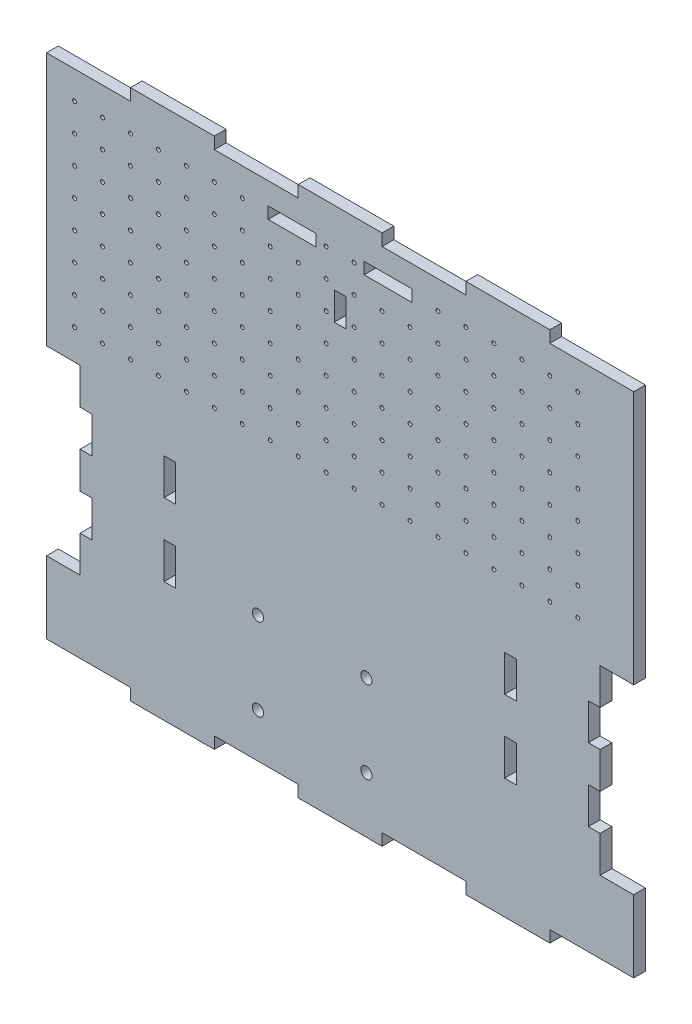
from build123d import *

# Parameters (mm, degrees)
SKETCH1_W           = 266.7
SKETCH1_H           = 241.3
BOSS_EXTRUDE1_DEPTH = 5.334
SKETCH2_W           = 15.24
SKETCH2_H           = 82.55
CUT_EXTRUDE1_DEPTH  = 180.908578328
SKETCH9_W           = 5.334
SKETCH9_H           = 16.51
CUT_EXTRUDE2_DEPTH  = 180.908578328
SKETCH10_R          = 2.54
CUT_EXTRUDE3_DEPTH  = 180.908578328
SKETCH23_W          = 5.334
SKETCH23_H          = 16.51
CUT_EXTRUDE8_DEPTH  = 180.908578328
SKETCH19_W          = 21.791696412
SKETCH19_H          = 5.334
CUT_EXTRUDE9_DEPTH  = 180.908578328
SKETCH19_5_W        = 21.791696412
SKETCH19_5_H        = 5.334
CUT_EXTRUDE11_DEPTH = 180.908578328
SKETCH27_W          = 5.334
SKETCH27_H          = 12.7
CUT_EXTRUDE12_DEPTH = 180.908578328
SKETCH28_W          = 38.1
SKETCH28_H          = 5.334
CUT_EXTRUDE13_DEPTH = 180.908578328
SKETCH29_W          = 38.1
SKETCH29_H          = 5.334
CUT_EXTRUDE14_DEPTH = 180.908578328
SKETCH30_R          = 0.889
CUT_EXTRUDE15_DEPTH = 180.908578328


with BuildPart() as part:
    # Sketch1 → Boss-Extrude1 (new body)
    with BuildSketch(Plane.XY):
        Rectangle(SKETCH1_W, SKETCH1_H)
    extrude(amount=BOSS_EXTRUDE1_DEPTH)

    # Sketch2 → Cut-Extrude1 (cut, through all)
    with BuildSketch(Plane(origin=(0, 0, 0), x_dir=(-1, 0, 0), z_dir=(0, 0, -1))):
        with Locations((125.73, -41.275)):
            Rectangle(SKETCH2_W, SKETCH2_H)
        with Locations((-125.73, -41.275)):
            Rectangle(SKETCH2_W, SKETCH2_H)
    extrude(amount=-CUT_EXTRUDE1_DEPTH, mode=Mode.SUBTRACT)

    # Sketch9 → Cut-Extrude2 (cut, through all)
    with BuildSketch(Plane.XY.offset(5.334)):
        with Locations((-115.443, -24.765)):
            Rectangle(SKETCH9_W, SKETCH9_H)
        with Locations((-115.443, -57.785)):
            Rectangle(SKETCH9_W, SKETCH9_H)
        with Locations((115.443, -57.785)):
            Rectangle(SKETCH9_W, SKETCH9_H)
        with Locations((115.443, -24.765)):
            Rectangle(SKETCH9_W, SKETCH9_H)
    extrude(amount=-CUT_EXTRUDE2_DEPTH, mode=Mode.SUBTRACT)

    # Sketch10 → Cut-Extrude3 (cut, through all)
    with BuildSketch(Plane.XY.offset(5.334)):
        with Locations((-37.338, -95.25)):
            Circle(SKETCH10_R)
        with Locations((11.938, -95.25)):
            Circle(SKETCH10_R)
        with Locations((11.938, -57.912)):
            Circle(SKETCH10_R)
        with Locations((-37.338, -57.912)):
            Circle(SKETCH10_R)
    extrude(amount=-CUT_EXTRUDE3_DEPTH, mode=Mode.SUBTRACT)

    # Sketch23 → Cut-Extrude8 (cut, through all)
    with BuildSketch(Plane.XY.offset(5.334)):
        with Locations((-77.343, -57.785)):
            Rectangle(SKETCH23_W, SKETCH23_H)
        with Locations((77.343, -24.765)):
            Rectangle(SKETCH23_W, SKETCH23_H)
        with Locations((77.343, -57.785)):
            Rectangle(SKETCH23_W, SKETCH23_H)
        with Locations((-77.343, -24.765)):
            Rectangle(SKETCH23_W, SKETCH23_H)
    extrude(amount=-CUT_EXTRUDE8_DEPTH, mode=Mode.SUBTRACT)

    # Sketch19 → Cut-Extrude9 (cut, through all)
    with BuildSketch(Plane.XY.offset(5.334)):
        with Locations((-21.791696412, 102.743)):
            Rectangle(SKETCH19_W, SKETCH19_H)
    extrude(amount=-CUT_EXTRUDE9_DEPTH, mode=Mode.SUBTRACT)

    # Sketch19<5> → Cut-Extrude11 (cut, through all)
    with BuildSketch(Plane.XY.offset(5.334)):
        with Locations((-21.791696412, 102.743)):
            Rectangle(SKETCH19_5_W, SKETCH19_5_H)
        with Locations((21.791696412, 102.743)):
            Rectangle(SKETCH19_5_W, SKETCH19_5_H)
    extrude(amount=-CUT_EXTRUDE11_DEPTH, mode=Mode.SUBTRACT)

    # Sketch27 → Cut-Extrude12 (cut, through all)
    with BuildSketch(Plane.XY.offset(5.334)):
        with Locations((0, 81.026)):
            Rectangle(SKETCH27_W, SKETCH27_H)
    extrude(amount=-CUT_EXTRUDE12_DEPTH, mode=Mode.SUBTRACT)

    # Sketch28 → Cut-Extrude13 (cut, through all)
    with BuildSketch(Plane(origin=(0, 0, 0), x_dir=(-1, 0, 0), z_dir=(0, 0, -1))):
        with Locations((-114.3, -117.983)):
            Rectangle(SKETCH28_W, SKETCH28_H)
        with Locations((-38.1, -117.983)):
            Rectangle(SKETCH28_W, SKETCH28_H)
        with Locations((38.1, -117.983)):
            Rectangle(SKETCH28_W, SKETCH28_H)
        with Locations((114.3, -117.983)):
            Rectangle(SKETCH28_W, SKETCH28_H)
    extrude(amount=-CUT_EXTRUDE13_DEPTH, mode=Mode.SUBTRACT)

    # Sketch29 → Cut-Extrude14 (cut, through all)
    with BuildSketch(Plane(origin=(0, 0, 0), x_dir=(-1, 0, 0), z_dir=(0, 0, -1))):
        with Locations((-114.3, 117.983)):
            Rectangle(SKETCH29_W, SKETCH29_H)
        with Locations((-38.1, 117.983)):
            Rectangle(SKETCH29_W, SKETCH29_H)
        with Locations((38.1, 117.983)):
            Rectangle(SKETCH29_W, SKETCH29_H)
        with Locations((114.3, 117.983)):
            Rectangle(SKETCH29_W, SKETCH29_H)
    extrude(amount=-CUT_EXTRUDE14_DEPTH, mode=Mode.SUBTRACT)

    # Sketch30 → Cut-Extrude15 (cut, through all)
    with BuildSketch(Plane.XY.offset(5.334)):
        with Locations((-120.65, 102.616)):
            Circle(SKETCH30_R)
        with Locations((-107.95, 102.616)):
            Circle(SKETCH30_R)
        with Locations((-95.25, 102.616)):
            Circle(SKETCH30_R)
        with Locations((-82.55, 102.616)):
            Circle(SKETCH30_R)
        with Locations((-69.85, 102.616)):
            Circle(SKETCH30_R)
        with Locations((-57.15, 102.616)):
            Circle(SKETCH30_R)
        with Locations((-44.45, 102.616)):
            Circle(SKETCH30_R)
        with Locations((-6.35, 102.616)):
            Circle(SKETCH30_R)
        with Locations((6.35, 102.616)):
            Circle(SKETCH30_R)
        with Locations((44.45, 102.616)):
            Circle(SKETCH30_R)
        with Locations((57.15, 102.616)):
            Circle(SKETCH30_R)
        with Locations((69.85, 102.616)):
            Circle(SKETCH30_R)
        with Locations((82.55, 102.616)):
            Circle(SKETCH30_R)
        with Locations((95.25, 102.616)):
            Circle(SKETCH30_R)
        with Locations((107.95, 102.616)):
            Circle(SKETCH30_R)
        with Locations((-107.95, 89.916)):
            Circle(SKETCH30_R)
        with Locations((-95.25, 89.916)):
            Circle(SKETCH30_R)
        with Locations((-82.55, 89.916)):
            Circle(SKETCH30_R)
        with Locations((-69.85, 89.916)):
            Circle(SKETCH30_R)
        with Locations((-57.15, 89.916)):
            Circle(SKETCH30_R)
        with Locations((-44.45, 89.916)):
            Circle(SKETCH30_R)
        with Locations((-31.75, 89.916)):
            Circle(SKETCH30_R)
        with Locations((-19.05, 89.916)):
            Circle(SKETCH30_R)
        with Locations((-6.35, 89.916)):
            Circle(SKETCH30_R)
        with Locations((6.35, 89.916)):
            Circle(SKETCH30_R)
        with Locations((19.05, 89.916)):
            Circle(SKETCH30_R)
        with Locations((31.75, 89.916)):
            Circle(SKETCH30_R)
        with Locations((44.45, 89.916)):
            Circle(SKETCH30_R)
        with Locations((57.15, 89.916)):
            Circle(SKETCH30_R)
        with Locations((69.85, 89.916)):
            Circle(SKETCH30_R)
        with Locations((82.55, 89.916)):
            Circle(SKETCH30_R)
        with Locations((95.25, 89.916)):
            Circle(SKETCH30_R)
        with Locations((107.95, 89.916)):
            Circle(SKETCH30_R)
        with Locations((-107.95, 77.216)):
            Circle(SKETCH30_R)
        with Locations((-95.25, 77.216)):
            Circle(SKETCH30_R)
        with Locations((-82.55, 77.216)):
            Circle(SKETCH30_R)
        with Locations((-69.85, 77.216)):
            Circle(SKETCH30_R)
        with Locations((-57.15, 77.216)):
            Circle(SKETCH30_R)
        with Locations((-44.45, 77.216)):
            Circle(SKETCH30_R)
        with Locations((-31.75, 77.216)):
            Circle(SKETCH30_R)
        with Locations((-19.05, 77.216)):
            Circle(SKETCH30_R)
        with Locations((-6.35, 77.216)):
            Circle(SKETCH30_R)
        with Locations((6.35, 77.216)):
            Circle(SKETCH30_R)
        with Locations((19.05, 77.216)):
            Circle(SKETCH30_R)
        with Locations((31.75, 77.216)):
            Circle(SKETCH30_R)
        with Locations((44.45, 77.216)):
            Circle(SKETCH30_R)
        with Locations((57.15, 77.216)):
            Circle(SKETCH30_R)
        with Locations((69.85, 77.216)):
            Circle(SKETCH30_R)
        with Locations((82.55, 77.216)):
            Circle(SKETCH30_R)
        with Locations((95.25, 77.216)):
            Circle(SKETCH30_R)
        with Locations((107.95, 77.216)):
            Circle(SKETCH30_R)
        with Locations((-107.95, 64.516)):
            Circle(SKETCH30_R)
        with Locations((-95.25, 64.516)):
            Circle(SKETCH30_R)
        with Locations((-82.55, 64.516)):
            Circle(SKETCH30_R)
        with Locations((-69.85, 64.516)):
            Circle(SKETCH30_R)
        with Locations((-57.15, 64.516)):
            Circle(SKETCH30_R)
        with Locations((-44.45, 64.516)):
            Circle(SKETCH30_R)
        with Locations((-31.75, 64.516)):
            Circle(SKETCH30_R)
        with Locations((-19.05, 64.516)):
            Circle(SKETCH30_R)
        with Locations((-6.35, 64.516)):
            Circle(SKETCH30_R)
        with Locations((6.35, 64.516)):
            Circle(SKETCH30_R)
        with Locations((19.05, 64.516)):
            Circle(SKETCH30_R)
        with Locations((31.75, 64.516)):
            Circle(SKETCH30_R)
        with Locations((44.45, 64.516)):
            Circle(SKETCH30_R)
        with Locations((57.15, 64.516)):
            Circle(SKETCH30_R)
        with Locations((69.85, 64.516)):
            Circle(SKETCH30_R)
        with Locations((82.55, 64.516)):
            Circle(SKETCH30_R)
        with Locations((95.25, 64.516)):
            Circle(SKETCH30_R)
        with Locations((107.95, 64.516)):
            Circle(SKETCH30_R)
        with Locations((-107.95, 51.816)):
            Circle(SKETCH30_R)
        with Locations((-95.25, 51.816)):
            Circle(SKETCH30_R)
        with Locations((-82.55, 51.816)):
            Circle(SKETCH30_R)
        with Locations((-69.85, 51.816)):
            Circle(SKETCH30_R)
        with Locations((-57.15, 51.816)):
            Circle(SKETCH30_R)
        with Locations((-44.45, 51.816)):
            Circle(SKETCH30_R)
        with Locations((-31.75, 51.816)):
            Circle(SKETCH30_R)
        with Locations((-19.05, 51.816)):
            Circle(SKETCH30_R)
        with Locations((-6.35, 51.816)):
            Circle(SKETCH30_R)
        with Locations((6.35, 51.816)):
            Circle(SKETCH30_R)
        with Locations((19.05, 51.816)):
            Circle(SKETCH30_R)
        with Locations((31.75, 51.816)):
            Circle(SKETCH30_R)
        with Locations((44.45, 51.816)):
            Circle(SKETCH30_R)
        with Locations((57.15, 51.816)):
            Circle(SKETCH30_R)
        with Locations((69.85, 51.816)):
            Circle(SKETCH30_R)
        with Locations((82.55, 51.816)):
            Circle(SKETCH30_R)
        with Locations((95.25, 51.816)):
            Circle(SKETCH30_R)
        with Locations((107.95, 51.816)):
            Circle(SKETCH30_R)
        with Locations((-107.95, 39.116)):
            Circle(SKETCH30_R)
        with Locations((-95.25, 39.116)):
            Circle(SKETCH30_R)
        with Locations((-82.55, 39.116)):
            Circle(SKETCH30_R)
        with Locations((-69.85, 39.116)):
            Circle(SKETCH30_R)
        with Locations((-57.15, 39.116)):
            Circle(SKETCH30_R)
        with Locations((-44.45, 39.116)):
            Circle(SKETCH30_R)
        with Locations((-31.75, 39.116)):
            Circle(SKETCH30_R)
        with Locations((-19.05, 39.116)):
            Circle(SKETCH30_R)
        with Locations((-6.35, 39.116)):
            Circle(SKETCH30_R)
        with Locations((6.35, 39.116)):
            Circle(SKETCH30_R)
        with Locations((19.05, 39.116)):
            Circle(SKETCH30_R)
        with Locations((31.75, 39.116)):
            Circle(SKETCH30_R)
        with Locations((44.45, 39.116)):
            Circle(SKETCH30_R)
        with Locations((57.15, 39.116)):
            Circle(SKETCH30_R)
        with Locations((69.85, 39.116)):
            Circle(SKETCH30_R)
        with Locations((82.55, 39.116)):
            Circle(SKETCH30_R)
        with Locations((95.25, 39.116)):
            Circle(SKETCH30_R)
        with Locations((107.95, 39.116)):
            Circle(SKETCH30_R)
        with Locations((-107.95, 26.416)):
            Circle(SKETCH30_R)
        with Locations((-95.25, 26.416)):
            Circle(SKETCH30_R)
        with Locations((-82.55, 26.416)):
            Circle(SKETCH30_R)
        with Locations((-69.85, 26.416)):
            Circle(SKETCH30_R)
        with Locations((-57.15, 26.416)):
            Circle(SKETCH30_R)
        with Locations((-44.45, 26.416)):
            Circle(SKETCH30_R)
        with Locations((-31.75, 26.416)):
            Circle(SKETCH30_R)
        with Locations((-19.05, 26.416)):
            Circle(SKETCH30_R)
        with Locations((-6.35, 26.416)):
            Circle(SKETCH30_R)
        with Locations((6.35, 26.416)):
            Circle(SKETCH30_R)
        with Locations((19.05, 26.416)):
            Circle(SKETCH30_R)
        with Locations((31.75, 26.416)):
            Circle(SKETCH30_R)
        with Locations((44.45, 26.416)):
            Circle(SKETCH30_R)
        with Locations((57.15, 26.416)):
            Circle(SKETCH30_R)
        with Locations((69.85, 26.416)):
            Circle(SKETCH30_R)
        with Locations((82.55, 26.416)):
            Circle(SKETCH30_R)
        with Locations((95.25, 26.416)):
            Circle(SKETCH30_R)
        with Locations((107.95, 26.416)):
            Circle(SKETCH30_R)
        with Locations((-107.95, 13.716)):
            Circle(SKETCH30_R)
        with Locations((-95.25, 13.716)):
            Circle(SKETCH30_R)
        with Locations((-82.55, 13.716)):
            Circle(SKETCH30_R)
        with Locations((-69.85, 13.716)):
            Circle(SKETCH30_R)
        with Locations((-57.15, 13.716)):
            Circle(SKETCH30_R)
        with Locations((-44.45, 13.716)):
            Circle(SKETCH30_R)
        with Locations((-31.75, 13.716)):
            Circle(SKETCH30_R)
        with Locations((-19.05, 13.716)):
            Circle(SKETCH30_R)
        with Locations((-6.35, 13.716)):
            Circle(SKETCH30_R)
        with Locations((6.35, 13.716)):
            Circle(SKETCH30_R)
        with Locations((19.05, 13.716)):
            Circle(SKETCH30_R)
        with Locations((31.75, 13.716)):
            Circle(SKETCH30_R)
        with Locations((44.45, 13.716)):
            Circle(SKETCH30_R)
        with Locations((57.15, 13.716)):
            Circle(SKETCH30_R)
        with Locations((69.85, 13.716)):
            Circle(SKETCH30_R)
        with Locations((82.55, 13.716)):
            Circle(SKETCH30_R)
        with Locations((95.25, 13.716)):
            Circle(SKETCH30_R)
        with Locations((107.95, 13.716)):
            Circle(SKETCH30_R)
        with Locations((-120.65, 89.916)):
            Circle(SKETCH30_R)
        with Locations((-120.65, 77.216)):
            Circle(SKETCH30_R)
        with Locations((-120.65, 64.516)):
            Circle(SKETCH30_R)
        with Locations((-120.65, 51.816)):
            Circle(SKETCH30_R)
        with Locations((-120.65, 39.116)):
            Circle(SKETCH30_R)
        with Locations((-120.65, 26.416)):
            Circle(SKETCH30_R)
        with Locations((-120.65, 13.716)):
            Circle(SKETCH30_R)
    extrude(amount=-CUT_EXTRUDE15_DEPTH, mode=Mode.SUBTRACT)


solid = part.part
